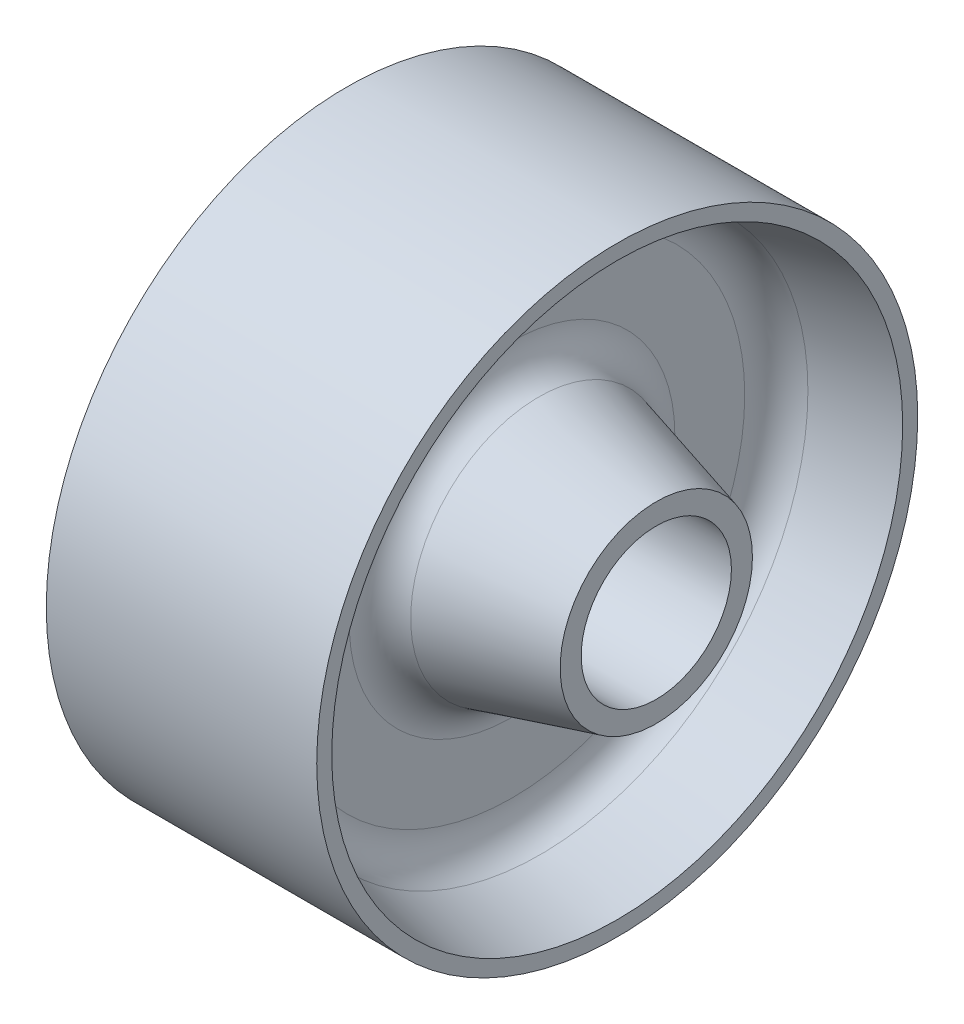
from build123d import *

# Parameters (mm, degrees)
F_3DSKETCH5_R      = 12.5
CUT_EXTRUDE1_DEPTH = 58


with BuildPart() as part:
    # Sketch3 → Revolve7 (revolve)
    with BuildSketch(Plane(origin=(0, 0, 0), x_dir=(1, 0, 0), z_dir=(0, 1, 0))):
        with BuildLine():
            Line((29, 0), (29, 16))
            Line((29, 16), (9.431507146, 21.299800148))
            ThreePointArc((9.431507146, 21.299800148), (6.234973393, 23.444993074), (5, 27.09115838))
            Line((5, 27.09115838), (5, 38.716689233))
            ThreePointArc((5, 38.716689233), (6.30842815, 42.456896924), (9.663051191, 44.565840272))
            Line((9.663051191, 44.565840272), (22.5, 47.5))
            Line((22.5, 47.5), (22.5, 50))
            Line((22.5, 50), (-22.5, 50))
            Line((-22.5, 50), (-22.5, 47.5))
            Line((-22.5, 47.5), (-9.663051191, 44.565840272))
            ThreePointArc((-9.663051191, 44.565840272), (-6.30842815, 42.456896924), (-5, 38.716689233))
            Line((-5, 38.716689233), (-5, 27.09115838))
            ThreePointArc((-5, 27.09115838), (-6.234973393, 23.444993074), (-9.431507146, 21.299800148))
            Line((-9.431507146, 21.299800148), (-29, 16))
            Line((-29, 16), (-29, 0))
            Line((-29, 0), (29, 0))
        make_face()
    revolve(axis=Axis((29, 0, 0), (-1, 0, 0)))

    # 3DSketch5 → Cut-Extrude1 (cut)
    with BuildSketch(Plane(origin=(-29, 0, 0), x_dir=(0, 0, 1), z_dir=(1, 0, 0))):
        Circle(F_3DSKETCH5_R)
    extrude(amount=CUT_EXTRUDE1_DEPTH, mode=Mode.SUBTRACT)


solid = part.part
